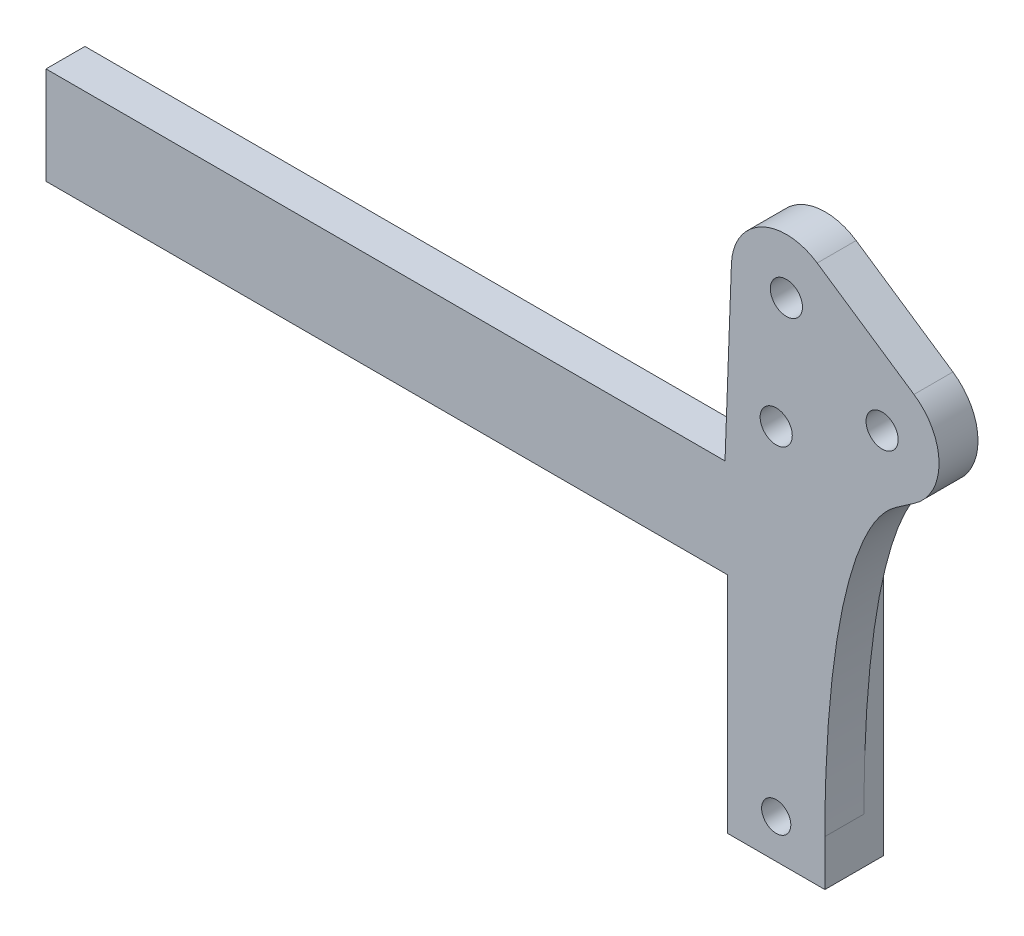
from build123d import *

# Parameters (mm, degrees)
IZIM1_W                     = 80
IZIM1_H                     = 10
IZIM1_W_2                   = 10
IZIM1_H_2                   = 40
Y_KSEKLIK_EKSTR_ZYON1_DEPTH = 6
IZIM1_3_W                   = 70
IZIM1_3_H                   = 10
KES_EKSTR_ZYON1_DEPTH       = 2
IZIM4_R                     = 1.5
IZIM4_R_2                   = 1.65
Y_KSEKLIK_EKSTR_ZYON4_DEPTH = 4
IZIM4_3_R                   = 1.5
IZIM4_3_R_2                 = 1.65
KES_EKSTR_ZYON3_DEPTH       = 5
KES_EKSTR_ZYON5_START       = 6
IZIM4_6_R                   = 1.5
IZIM4_6_R_2                 = 1.65
KES_EKSTR_ZYON5_DEPTH       = 6


with BuildPart() as part:
    # Çizim1 → Yükseklik-Ekstrüzyon1 (new body)
    with BuildSketch(Plane.XY):
        Rectangle(IZIM1_W, IZIM1_H)
        with Locations((35, -8)):
            Rectangle(IZIM1_W_2, IZIM1_H_2)
    extrude(amount=Y_KSEKLIK_EKSTR_ZYON1_DEPTH)

    # Çizim1<3> → Kes-Ekstrüzyon1 (cut)
    with BuildSketch(Plane.XY):
        with Locations((-5, 0)):
            Rectangle(IZIM1_3_W, IZIM1_3_H)
    extrude(amount=KES_EKSTR_ZYON1_DEPTH, mode=Mode.SUBTRACT)

    # Çizim4 → Yükseklik-Ekstrüzyon4 (add)
    # profile 1 of 2: a face of its own
    with BuildSketch(Plane(origin=(0, 0, 2), x_dir=(-1, 0, 0), z_dir=(0, 0, -1))):
        with Locations((-35, -24)):
            Circle(IZIM4_R)
    # profile 2 of 2: a face of its own
    with BuildSketch(Plane(origin=(0, 0, 2), x_dir=(-1, 0, 0), z_dir=(0, 0, -1))):
        with BuildLine():
            Line((-29.73781884, 4.874886315), (-30.399690089, 22.862097513))
            ThreePointArc((-30.399690089, 22.862097513), (-33.487518923, 27.691929585), (-39.208988831, 27.335914357))
            Line((-39.208988831, 27.335914357), (-49.15078221, 20.618716695))
            ThreePointArc((-49.15078221, 20.618716695), (-51.725626297, 15.799448116), (-49.197080807, 10.955727499))
            Line((-49.197080807, 10.955727499), (-39.45690441, 4.237918054))
            ThreePointArc((-39.45690441, 4.237918054), (-34.486628982, 2.866804599), (-29.73781884, 4.874886315))
        make_face()
        with Locations((-36.045868913, 22.654336377)):
            Circle(IZIM4_R_2, mode=Mode.SUBTRACT)
        with Locations((-45.875693444, 15.771419141)):
            Circle(IZIM4_R_2, mode=Mode.SUBTRACT)
        with Locations((-35, 10.7)):
            Circle(IZIM4_R_2, mode=Mode.SUBTRACT)
    extrude(amount=-Y_KSEKLIK_EKSTR_ZYON4_DEPTH)

    # Çizim4<3> → Kes-Ekstrüzyon3 (cut, symmetric)
    with BuildSketch(Plane(origin=(0, 0, 2), x_dir=(-1, 0, 0), z_dir=(0, 0, -1))):
        with Locations(Location((-35, -24, 0), (0, 0, 180))):
            Circle(IZIM4_3_R)
        with Locations((-45.875693444, 15.771419141)):
            Circle(IZIM4_3_R_2)
        with Locations(Location((-35, 10.7, 0), (0, 0, 51.987720456))):
            Circle(IZIM4_3_R_2)
    extrude(amount=KES_EKSTR_ZYON3_DEPTH, both=True, mode=Mode.SUBTRACT)

    # Çizim4<6> → Kes-Ekstrüzyon5 (cut)
    # profile 1 of 2: a face of its own
    with BuildSketch(Plane(origin=(0, 0, 2), x_dir=(-1, 0, 0), z_dir=(0, 0, -1)).offset(KES_EKSTR_ZYON5_START)):
        with Locations(Location((-35, -24, 0), (0, 0, 180))):
            Circle(IZIM4_6_R)
    # profile 2 of 2: a face of its own
    with BuildSketch(Plane(origin=(0, 0, 2), x_dir=(-1, 0, 0), z_dir=(0, 0, -1)).offset(KES_EKSTR_ZYON5_START)):
        with BuildLine():
            Line((-29.73781884, 4.874886315), (-30.399690089, 22.862097513))
            ThreePointArc((-30.399690089, 22.862097513), (-33.487518923, 27.691929585), (-39.208988831, 27.335914357))
            Line((-39.208988831, 27.335914357), (-49.15078221, 20.618716695))
            ThreePointArc((-49.15078221, 20.618716695), (-51.725626297, 15.799448116), (-49.197080807, 10.955727499))
            Line((-49.197080807, 10.955727499), (-39.45690441, 4.237918054))
            ThreePointArc((-39.45690441, 4.237918054), (-34.486628982, 2.866804599), (-29.73781884, 4.874886315))
        make_face()
        with Locations((-36.045868913, 22.654336377)):
            Circle(IZIM4_6_R_2, mode=Mode.SUBTRACT)
        with Locations((-45.875693444, 15.771419141)):
            Circle(IZIM4_6_R_2, mode=Mode.SUBTRACT)
        with Locations((-35, 10.7)):
            Circle(IZIM4_6_R_2, mode=Mode.SUBTRACT)
    extrude(amount=-KES_EKSTR_ZYON5_DEPTH, mode=Mode.SUBTRACT)

    # Radyus2
    # a fillet whose section is not a circle: 40, 30 mm, written as the material it adds along each edge
    with BuildSketch(Plane(origin=(40, 4.612491628, 2), x_dir=(0, -1, 0), z_dir=(0, 0, 1))) as radyus2_piece_1:
        with BuildLine():
            Bezier((27.900120921, 0), (0, 0), (-5.027685175, 7.289659058), weights=[1, 0.885369562, 1])
            Line((-5.027685175, 7.289659058), (0, 0))
            Line((0, 0), (27.900120921, 0))
        make_face()
    extrude(amount=4)


solid = part.part
